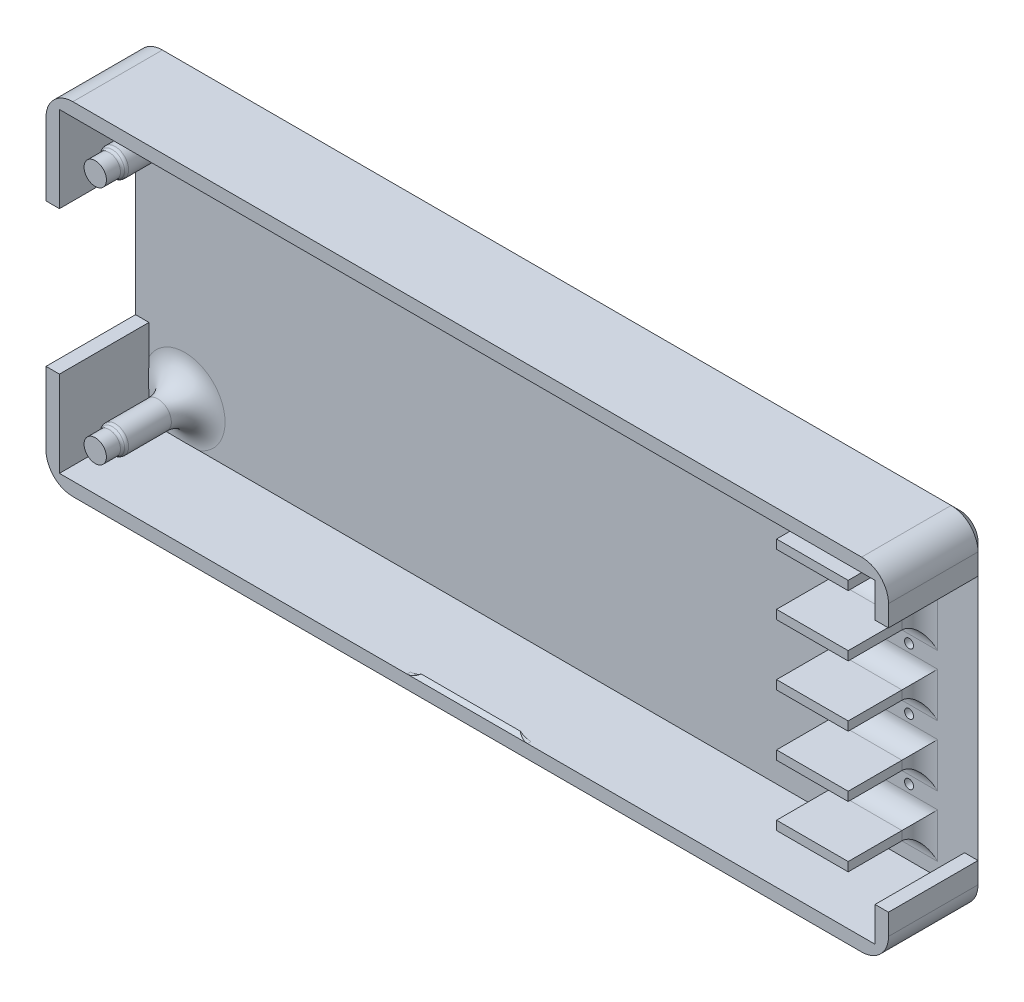
from build123d import *

# Parameters (mm, degrees)
SKETCH1_W                = 94.1
SKETCH1_H                = 38.2
SKETCH1_W_2              = 91.1
SKETCH1_H_2              = 35.2
BOSS_EXTRUDE1_DEPTH      = 1
SKETCH1_3_W              = 94.1
SKETCH1_3_H              = 38.2
SKETCH1_3_W_2            = 91.1
SKETCH1_3_H_2            = 35.2
BOSS_EXTRUDE2_DEPTH      = 11
SKETCH2_W                = 1.5
SKETCH2_H                = 16
SKETCH2_H_2              = 27.5
CUT_EXTRUDE1_DEPTH       = 10
SKETCH3_W                = 8
SKETCH3_H                = 1
BOSS_EXTRUDE3_DEPTH      = 8
SKETCH4_R                = 0.5
CUT_EXTRUDE2_DEPTH       = 10
SKETCH5_R                = 1.5
BOSS_EXTRUDE4_DEPTH      = 8
SKETCH7_R                = 1.25
BOSS_EXTRUDE6_DEPTH      = 2
FILLET1_R                = 3
FILLET2_R                = 2
FILLET3_R                = 3
CHAMFER2_SIZE            = 1
SKETCH6_W                = 10
SKETCH6_H                = 0.4
BOSS_EXTRUDE5_DEPTH      = 1
FILLET4_R                = 2
CHAMFER3_SIZE            = 1
FILLET5_R                = 0.5
FILLET6_R                = 0.5
FILLET4_OF_MIRROR2_R     = 2
CHAMFER3_OF_MIRROR2_SIZE = 1


# Some blends are built 0.0001 mm under size
with BuildPart() as part:
    # Sketch1 → Boss-Extrude1 (new body)
    # profile 1 of 2: a face of its own
    with BuildSketch(Plane.XY):
        with Locations((45.55, 17.6)):
            Rectangle(SKETCH1_W, SKETCH1_H)
        with Locations((45.55, 17.6)):
            Rectangle(SKETCH1_W_2, SKETCH1_H_2, mode=Mode.SUBTRACT)
    # profile 2 of 2: a face of its own
    with BuildSketch(Plane.XY):
        with Locations((45.55, 17.6)):
            Rectangle(SKETCH1_W_2, SKETCH1_H_2)
    extrude(amount=BOSS_EXTRUDE1_DEPTH)

    # Sketch1<3> → Boss-Extrude2 (add)
    with BuildSketch(Plane.XY):
        with Locations((45.55, 17.6)):
            Rectangle(SKETCH1_3_W, SKETCH1_3_H)
        with Locations((45.55, 17.6)):
            Rectangle(SKETCH1_3_W_2, SKETCH1_3_H_2, mode=Mode.SUBTRACT)
    extrude(amount=BOSS_EXTRUDE2_DEPTH)

    # Sketch2 → Cut-Extrude1 (cut)
    with BuildSketch(Plane.XY.offset(11)):
        with Locations((-0.75, 17.6)):
            Rectangle(SKETCH2_W, SKETCH2_H)
        with Locations((91.85, 17.6)):
            Rectangle(SKETCH2_W, SKETCH2_H_2)
    extrude(amount=-CUT_EXTRUDE1_DEPTH, mode=Mode.SUBTRACT)

    # Sketch3 → Boss-Extrude3 (add)
    with BuildSketch(Plane.XY.offset(1)):
        with Locations((82.1, 31.2)):
            Rectangle(SKETCH3_W, SKETCH3_H)
        with Locations((82.1, 24.4)):
            Rectangle(SKETCH3_W, SKETCH3_H)
        with Locations((82.1, 17.6)):
            Rectangle(SKETCH3_W, SKETCH3_H)
        with Locations((82.1, 10.8)):
            Rectangle(SKETCH3_W, SKETCH3_H)
        with Locations((82.1, 4)):
            Rectangle(SKETCH3_W, SKETCH3_H)
    extrude(amount=BOSS_EXTRUDE3_DEPTH)

    # Sketch4 → Cut-Extrude2 (cut)
    with BuildSketch(Plane.XY.offset(1)):
        with Locations((84.9, 27.8)):
            Circle(SKETCH4_R)
        with Locations((84.9, 21)):
            Circle(SKETCH4_R)
        with Locations((84.9, 14.2)):
            Circle(SKETCH4_R)
        with Locations((84.9, 7.4)):
            Circle(SKETCH4_R)
    extrude(amount=-CUT_EXTRUDE2_DEPTH, mode=Mode.SUBTRACT)

    # Sketch5 → Boss-Extrude4 (add)
    with BuildSketch(Plane.XY.offset(1)):
        with Locations((4, 31)):
            Circle(SKETCH5_R)
        with Locations((4, 4.2)):
            Circle(SKETCH5_R)
    extrude(amount=BOSS_EXTRUDE4_DEPTH)

    # Sketch7 → Boss-Extrude6 (add)
    with BuildSketch(Plane.XY.offset(9)):
        with Locations((4, 31)):
            Circle(SKETCH7_R)
        with Locations((4, 4.2)):
            Circle(SKETCH7_R)
    extrude(amount=BOSS_EXTRUDE6_DEPTH)

    # Fillet1
    # the kernel refuses this fillet: 3 mm, written as the material it adds along each edge
    with BuildSketch(Plane(origin=(4, 31, 1), x_dir=(1, 0, 0), z_dir=(0, -1, 0))) as fillet1_piece_1:
        with BuildLine():
            CenterArc((1.5 + FILLET1_R, FILLET1_R), FILLET1_R, 180, 90)
            Line((1.5, FILLET1_R), (1.5, 0))
            Line((1.5, 0), (1.5 + FILLET1_R, 0))
        make_face()
    revolve(axis=Axis((4, 31, 1), (0, 0, 1)))
    with BuildSketch(Plane(origin=(4, 4.2, 1), x_dir=(1, 0, 0), z_dir=(0, -1, 0))) as fillet1_piece_2:
        with BuildLine():
            CenterArc((1.5 + FILLET1_R, FILLET1_R), FILLET1_R, 180, 90)
            Line((1.5, FILLET1_R), (1.5, 0))
            Line((1.5, 0), (1.5 + FILLET1_R, 0))
        make_face()
    revolve(axis=Axis((4, 4.2, 1), (0, 0, 1)))

    # Fillet2
    fillet2_edges = [part.edges().sort_by_distance(p)[0] for p in [
        (78.1, 17.6, 1),
        (82.1, 17.1, 1),
        (86.1, 17.6, 1),
        (82.1, 18.1, 1),
        (78.1, 10.8, 1),
        (82.1, 10.3, 1),
        (86.1, 10.8, 1),
        (82.1, 11.3, 1),
        (78.1, 4, 1),
        (82.1, 3.5, 1),
        (86.1, 4, 1),
        (82.1, 4.5, 1),
        (78.1, 31.2, 1),
        (82.1, 30.7, 1),
        (86.1, 31.2, 1),
        (82.1, 31.7, 1),
        (78.1, 24.4, 1),
        (82.1, 23.9, 1),
        (86.1, 24.4, 1),
        (82.1, 24.9, 1),
    ]]
    fillet(fillet2_edges, radius=FILLET2_R)

    # Fillet3
    fillet3_edges = [part.edges().sort_by_distance(p)[0] for p in [
        (-1.5, 36.7, 5.5),
        (92.6, 36.7, 5.5),
        (92.6, -1.5, 5.5),
        (-1.5, -1.5, 5.5),
    ]]
    fillet(fillet3_edges, radius=FILLET3_R)

    # Chamfer2
    chamfer2_edges = [part.edges().sort_by_distance(p)[0] for p in [
        (-1.5, 17.6, 0),
        (45.55, 36.7, 0),
        (92.6, 17.6, 0),
        (45.55, -1.5, 0),
        (91.721320344, -0.621320344, 0),
        (-0.621320344, -0.621320344, 0),
        (91.721320344, 35.821320344, 0),
        (-0.621320344, 35.821320344, 0),
    ]]
    chamfer(chamfer2_edges, length=CHAMFER2_SIZE - 0.0001)  # a hair under: the kernel refuses the full size

    # Sketch6 → Boss-Extrude5 (add)
    with BuildSketch(Plane.XZ.offset(-35.2)):
        with Locations((45.55, 10.8)):
            Rectangle(SKETCH6_W, SKETCH6_H)
    boss_extrude5 = extrude(amount=BOSS_EXTRUDE5_DEPTH)

    # Fillet4
    # the kernel refuses this fillet: 2 mm, written as the material it adds along each edge
    with BuildSketch(Plane(origin=(40.55, 35.2, 10.6), x_dir=(-1, 0, 0), z_dir=(0, 0, 1)), Plane(origin=(50.55, 35.2, 11), x_dir=(1, 0, 0), z_dir=(0, 0, -1))) as fillet4_piece_1:
        with BuildLine():
            CenterArc((1.732050808, 2), FILLET4_R, 210, 60)
            Line((0, 1), (-0.034641016, 0.98))
            ThreePointArc((-0.034641016, 0.98), (-0.04, 0.5), (-0.04, 0))
            Line((-0.04, 0), (0, -0.04))
            Line((0, -0.04), (1.732050808, -0.04))
            Line((1.732050808, -0.04), (1.732050808, 0))
        make_face()
    extrude(amount=0.4)

    # Chamfer3
    # the kernel refuses this chamfer: 1 mm, written as the material it takes off along each edge
    with BuildSketch(Plane(origin=(37.978317012, 34.2, 11), x_dir=(0, 0.9996219169112968, 0.02749587661058555), z_dir=(1, 0, 0))) as chamfer3_piece_1:
        Polygon((CHAMFER3_SIZE * 0.999621916911, -CHAMFER3_SIZE * 0.0274958766106), (-CHAMFER3_SIZE * 0.0274958766106, -CHAMFER3_SIZE * 0.999621916911), (0, 0), align=None)
    extrude(amount=15.143365976, mode=Mode.SUBTRACT)

    # Fillet5
    # the kernel refuses this fillet: 0.5 mm, written as the material it adds along each edge
    with BuildSketch(Plane(origin=(4, 31, 9), x_dir=(1, 0, 0), z_dir=(0, -1, 0))) as fillet5_piece_1:
        with BuildLine():
            CenterArc((1.75, 0.433012702), FILLET5_R, 180, 60)
            Line((1.25, 0.433012702), (1.24, 0.433012702))
            Line((1.24, 0.433012702), (1.24, 0))
            Line((1.24, 0), (1.25, -0.01))
            ThreePointArc((1.25, -0.01), (1.375, -0.01), (1.495, -0.008660254))
            Line((1.495, -0.008660254), (1.5, 0))
        make_face()
    revolve(axis=Axis((4, 31, 9), (0, 0, 1)))
    with BuildSketch(Plane(origin=(4, 4.2, 9), x_dir=(1, 0, 0), z_dir=(0, -1, 0))) as fillet5_piece_2:
        with BuildLine():
            CenterArc((1.75, 0.433012702), FILLET5_R, 180, 60)
            Line((1.25, 0.433012702), (1.24, 0.433012702))
            Line((1.24, 0.433012702), (1.24, 0))
            Line((1.24, 0), (1.25, -0.01))
            ThreePointArc((1.25, -0.01), (1.375, -0.01), (1.495, -0.008660254))
            Line((1.495, -0.008660254), (1.5, 0))
        make_face()
    revolve(axis=Axis((4, 4.2, 9), (0, 0, 1)))

    # Fillet6
    fillet6_edges = [part.edges().sort_by_distance(p)[0] for p in [
        (2.5, 31, 9),
        (2.5, 4.2, 9),
    ]]
    fillet(fillet6_edges, radius=FILLET6_R)

    # Mirror2: Boss-Extrude5 across plane
    add(boss_extrude5.mirror(Plane(origin=(0, 17.6, 0), x_dir=(0, 0, 1), z_dir=(0, -1, 0))))

    # Fillet4 of Mirror2
    # the kernel refuses this fillet: 2 mm, written as the material it adds along each edge
    with BuildSketch(Plane(origin=(40.55, 0, 10.6), x_dir=(-1, 0, 0), z_dir=(0, 0, 1)), Plane(origin=(50.55, 0, 11), x_dir=(1, 0, 0), z_dir=(0, 0, -1))) as fillet4_of_mirror2_piece_1:
        with BuildLine():
            CenterArc((1.732050808, -2), FILLET4_OF_MIRROR2_R, 90, 60)
            Line((0, -1), (-0.034641016, -0.98))
            ThreePointArc((-0.034641016, -0.98), (-0.04, -0.5), (-0.04, 0))
            Line((-0.04, 0), (0, 0.04))
            Line((0, 0.04), (1.732050808, 0.04))
            Line((1.732050808, 0.04), (1.732050808, 0))
        make_face()
    extrude(amount=0.4)

    # Chamfer3 of Mirror2
    # the kernel refuses this chamfer: 1 mm, written as the material it takes off along each edge
    with BuildSketch(Plane(origin=(37.978317012, 1, 11), x_dir=(0, -0.9996219169112968, 0.02749587661058563), z_dir=(1, 0, 0))) as chamfer3_of_mirror2_piece_1:
        Polygon((CHAMFER3_OF_MIRROR2_SIZE * 0.999621916911, CHAMFER3_OF_MIRROR2_SIZE * 0.0274958766106), (-CHAMFER3_OF_MIRROR2_SIZE * 0.0274958766106, CHAMFER3_OF_MIRROR2_SIZE * 0.999621916911), (0, 0), align=None)
    extrude(amount=15.143365976, mode=Mode.SUBTRACT)


solid = part.part
